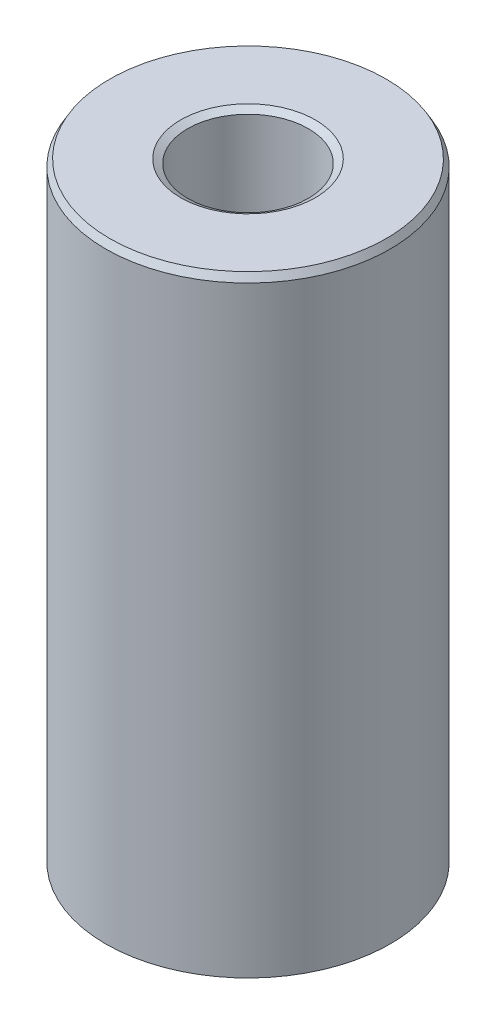
from build123d import *
from OCP.BRepFilletAPI import BRepFilletAPI_MakeChamfer

# Parameters (mm, degrees)
SKETCH1_R           = 42.5
BOSS_EXTRUDE1_DEPTH = 183.114524701
SKETCH2_R           = 18.040980122
CUT_EXTRUDE1_DEPTH  = 193.726306343
CHAMFER1_SIZE       = 2.09948792
CHAMFER1_SIZE2      = 1.212139916


with BuildPart() as part:
    # Sketch1 → Boss-Extrude1 (new body)
    with BuildSketch(Plane(origin=(0, 0, 0), x_dir=(1, 0, 0), z_dir=(0, 1, 0))):
        Circle(SKETCH1_R)
    extrude(amount=BOSS_EXTRUDE1_DEPTH)

    # Sketch2 → Cut-Extrude1 (cut, through all)
    with BuildSketch(Plane(origin=(0, 0, 0), x_dir=(1, 0, 0), z_dir=(0, 1, 0))):
        Circle(SKETCH2_R)
    extrude(amount=CUT_EXTRUDE1_DEPTH, mode=Mode.SUBTRACT)

    # Chamfer1: one chamfer whose edges measure the first distance from different faces: ONE call of the kernel's chamfer builder (chamfer() names one face for all edges)
    chamfer1_edges_1 = [part.edges().sort_by_distance(p)[0] for p in [
        (-18.040980122, 183.114524701, 0),
    ]]
    chamfer1_side_1 = [part.faces().sort_by_distance(p)[0] for p in [
        (-41.297918472, 183.114524701, 0),
    ]]
    chamfer1_edges_2 = [part.edges().sort_by_distance(p)[0] for p in [
        (-18.040980122, 0, 0),
    ]]
    chamfer1_side_2 = [part.faces().sort_by_distance(p)[0] for p in [
        (-18.040980122, 91.557262351, 0),
    ]]
    chamfer1_edges_3 = [part.edges().sort_by_distance(p)[0] for p in [
        (-42.5, 0, 0),
    ]]
    chamfer1_side_3 = [part.faces().sort_by_distance(p)[0] for p in [
        (-41.297918472, 0, 0),
    ]]
    chamfer1_edges_4 = [part.edges().sort_by_distance(p)[0] for p in [
        (-42.5, 183.114524701, 0),
    ]]
    chamfer1_side_4 = [part.faces().sort_by_distance(p)[0] for p in [
        (-42.5, 91.557262351, 0),
    ]]
    chamfer1 = BRepFilletAPI_MakeChamfer(part.part.solid().wrapped)
    for e in chamfer1_edges_1:
        chamfer1.Add(CHAMFER1_SIZE, CHAMFER1_SIZE2, e.wrapped, chamfer1_side_1[0].wrapped)  # the first distance lies on this face
    for e in chamfer1_edges_2:
        chamfer1.Add(CHAMFER1_SIZE, CHAMFER1_SIZE2, e.wrapped, chamfer1_side_2[0].wrapped)  # the first distance lies on this face
    for e in chamfer1_edges_3:
        chamfer1.Add(CHAMFER1_SIZE, CHAMFER1_SIZE2, e.wrapped, chamfer1_side_3[0].wrapped)  # the first distance lies on this face
    for e in chamfer1_edges_4:
        chamfer1.Add(CHAMFER1_SIZE, CHAMFER1_SIZE2, e.wrapped, chamfer1_side_4[0].wrapped)  # the first distance lies on this face
    add(Compound.cast(chamfer1.Shape()), mode=Mode.REPLACE)


solid = part.part
